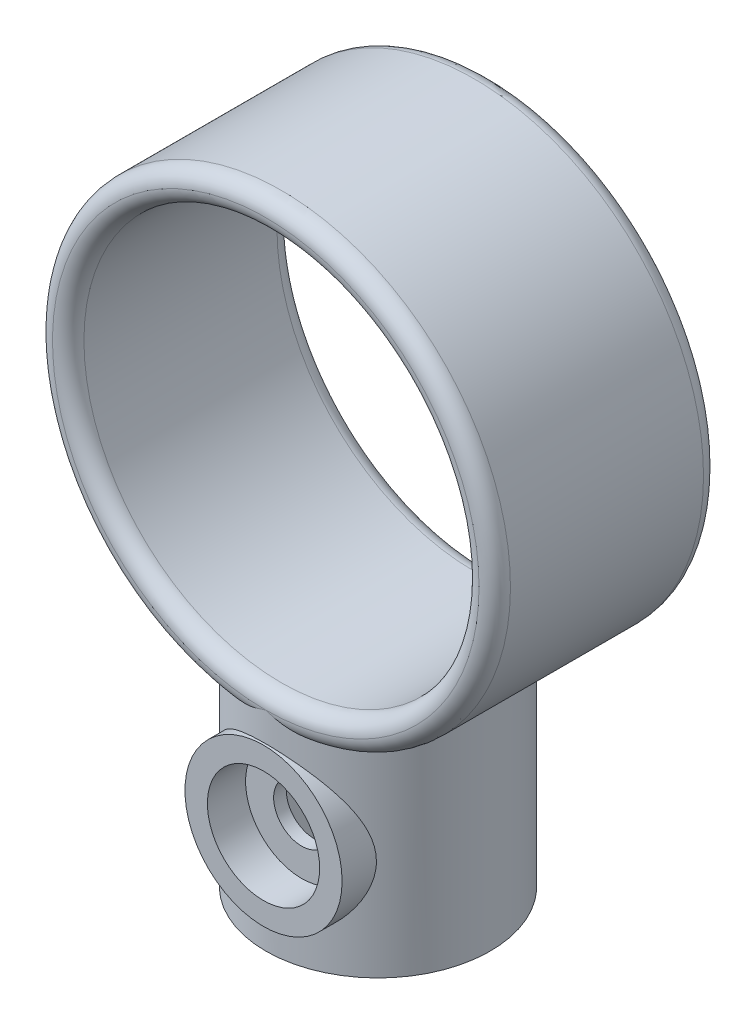
from build123d import *

# Parameters (mm, degrees)
SKETCH1_R           = 11.176
BASE_EXTRUDE_DEPTH  = 6.35
SHELL1_T            = 1.778
FILLET1_R           = 0.889
BOSS_EXTRUDE1_REACH = 41.555
SKETCH2_R           = 6.35
CUT_EXTRUDE1_DEPTH  = 10.795
BOSS_EXTRUDE2_REACH = 37.383
SKETCH4_R           = 4.445
SKETCH5_R           = 3.175
CUT_EXTRUDE2_DEPTH  = 2.159
CUT_EXTRUDE3_REACH  = 31.183
SKETCH6_R           = 1.5875


with BuildPart() as part:
    # Sketch1 → Base-Extrude (new, symmetric)
    with BuildSketch(Plane.XY):
        Circle(SKETCH1_R)
    extrude(amount=BASE_EXTRUDE_DEPTH, both=True)

    # Shell1
    shell1_openings = [part.faces().sort_by_distance(p)[0] for p in [
        (0, 0, 6.35),
        (0, 0, -6.35),
    ]]
    offset(amount=SHELL1_T, openings=shell1_openings, kind=Kind.INTERSECTION)

    # Fillet1
    # the kernel refuses this fillet: 0.889 mm, written as the material it takes off along each edge
    with BuildSketch(Plane(origin=(0, 0, -6.35), x_dir=(1, 0, 0), z_dir=(0, -1, 0))) as fillet1_piece_1:
        with BuildLine():
            CenterArc((12.954 - FILLET1_R, FILLET1_R), FILLET1_R, 270, 90)
            Line((12.954 - FILLET1_R, 0), (12.954, 0))
            Line((12.954, 0), (12.954, FILLET1_R))
        make_face()
    revolve(axis=Axis((0, 0, -6.35), (0, 0, 1)), mode=Mode.SUBTRACT)
    with BuildSketch(Plane(origin=(0, 0, 6.35), x_dir=(1, 0, 0), z_dir=(0, -1, 0))) as fillet1_piece_2:
        with BuildLine():
            CenterArc((12.954 - FILLET1_R, -FILLET1_R), FILLET1_R, 0, 90)
            Line((12.954, -FILLET1_R), (12.954, 0))
            Line((12.954, 0), (12.954 - FILLET1_R, 0))
        make_face()
    revolve(axis=Axis((0, 0, 6.35), (0, 0, 1)), mode=Mode.SUBTRACT)
    with BuildSketch(Plane(origin=(0, 0, -6.35), x_dir=(1, 0, 0), z_dir=(0, -1, 0))) as fillet1_piece_3:
        with BuildLine():
            CenterArc((11.176 + FILLET1_R, FILLET1_R), FILLET1_R, 180, 90)
            Line((11.176 + FILLET1_R, 0), (11.176, 0))
            Line((11.176, 0), (11.176, FILLET1_R))
        make_face()
    revolve(axis=Axis((0, 0, -6.35), (0, 0, 1)), mode=Mode.SUBTRACT)
    with BuildSketch(Plane(origin=(0, 0, 6.35), x_dir=(1, 0, 0), z_dir=(0, -1, 0))) as fillet1_piece_4:
        with BuildLine():
            CenterArc((11.176 + FILLET1_R, -FILLET1_R), FILLET1_R, 90, 90)
            Line((11.176 + FILLET1_R, 0), (11.176, 0))
            Line((11.176, 0), (11.176, -FILLET1_R))
        make_face()
    revolve(axis=Axis((0, 0, 6.35), (0, 0, 1)), mode=Mode.SUBTRACT)

    # Sketch2 → Boss-Extrude1 (add, up to next)
    with BuildSketch(Plane(origin=(0, -23.876, 0), x_dir=(-1, 0, 0), z_dir=(0, 1, 0)), mode=Mode.PRIVATE) as boss_extrude1_sk1:
        with Locations(Location((0, 0, 0), (0, 0, 90))):
            Circle(SKETCH2_R)
    boss_extrude1_tool1 = extrude(boss_extrude1_sk1.sketch, amount=BOSS_EXTRUDE1_REACH, mode=Mode.PRIVATE) - part.part
    add(boss_extrude1_tool1.solids().sort_by_distance((0, -23.876, 0))[0])

    # Sketch3 → Cut-Extrude1 (cut)
    with BuildSketch(Plane.XZ.offset(23.876)):
        with BuildLine():
            Line((-1.5875, 3.60275072), (1.5875, 3.60275072))
            ThreePointArc((1.5875, 3.60275072), (0, -3.937), (-1.5875, 3.60275072))
        make_face()
    extrude(amount=-CUT_EXTRUDE1_DEPTH, mode=Mode.SUBTRACT)

    # Sketch4 → Boss-Extrude2 (add, up to next)
    with BuildSketch(Plane(origin=(0, -17.371432399, 6.477), x_dir=(-1, 0, 0), z_dir=(0, 0, 1)), mode=Mode.PRIVATE) as boss_extrude2_sk1:
        with Locations(Location((0, 0.789567601, 0), (0, 0, 180))):
            Circle(SKETCH4_R)
    boss_extrude2_tool1 = extrude(boss_extrude2_sk1.sketch, amount=-BOSS_EXTRUDE2_REACH, mode=Mode.PRIVATE) - part.part
    add(boss_extrude2_tool1.solids().sort_by_distance((0, -18.161, 6.477))[0])

    # Sketch5 → Cut-Extrude2 (cut)
    with BuildSketch(Plane.XY.offset(6.477)):
        with Locations((0, -18.161)):
            Circle(SKETCH5_R)
    extrude(amount=-CUT_EXTRUDE2_DEPTH, mode=Mode.SUBTRACT)

    # Sketch6 → Cut-Extrude3 (cut, up to next)
    with BuildSketch(Plane.XY.offset(4.318), mode=Mode.PRIVATE) as cut_extrude3_sk1:
        with Locations((0, -18.161)):
            Circle(SKETCH6_R)
    cut_extrude3_tool1 = extrude(cut_extrude3_sk1.sketch, amount=-CUT_EXTRUDE3_REACH, mode=Mode.PRIVATE) & part.part
    add(cut_extrude3_tool1.solids().sort_by_distance((0, -18.161, 4.318))[0], mode=Mode.SUBTRACT)


solid = part.part
